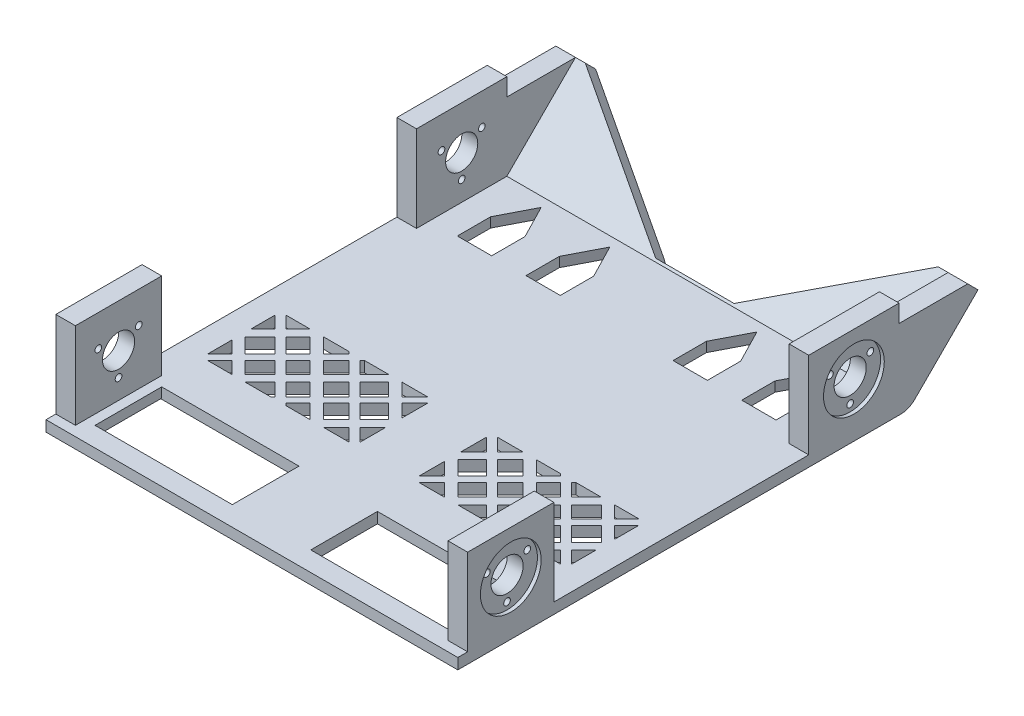
from build123d import *
from build123d.topology import SkipClean

# Parameters (mm, degrees)
SKETCH_1_W               = 5
SKETCH_1_H               = 10
EXTRUDE_1_DEPTH          = 5.5
SKETCH_3_W               = 5
SKETCH_3_H               = 46.066203836
SKETCH_3_H_2             = 44
EXTRUDE_2_DEPTH          = 44
CUT_EXTRUDE_1_DEPTH      = 316.357337
CUT_EXTRUDE_1_DEPTH_BACK = 316.357337
SKETCH_4_R               = 8.2
SKETCH_4_R_2             = 1.7
SKETCH_5_R               = 15.5
CUT_EXTRUDE_3_DEPTH      = 1.9
CUT_EXTRUDE_START        = -1.9
SKETCH_6_R               = 15.5
CUT_EXTRUDE_4_DEPTH      = 1.9
CUT_EXTRUDE_5_DEPTH      = 316.357337
CUT_EXTRUDE_5_DEPTH_BACK = 316.357337
SKETCH_7_R               = 8.2
SKETCH_7_R_2             = 1.7
SKETCH_8_R               = 15.5
CUT_EXTRUDE_6_DEPTH      = 1.9
SKETCH_9_R               = 15.5
CUT_EXTRUDE_7_DEPTH      = 1.9
SKETCH_10_W              = 10
SKETCH_10_H              = 34
EXTRUDE_3_DEPTH          = 5
SKETCH_11_W              = 5
SKETCH_11_H              = 41.066203836
SKETCH_11_H_2            = 5
SKETCH_11_H_3            = 44
EXTRUDE_4_DEPTH          = 44
CUT_EXTRUDE_8_DEPTH      = 315.095304008
CUT_EXTRUDE_8_DEPTH_BACK = 315.095304008
SKETCH_12_R              = 1.7
SKETCH_12_R_2            = 8.2
SKETCH_17_W              = 210
SKETCH_17_H              = 49.493882771
EXTRUDE_5_DEPTH          = 7.424621
EXTRUDE_6_DEPTH          = 10
EXTRUDE_8_DEPTH          = 10
SKETCH_20_W              = 40
SKETCH_20_H              = 48.239190952
CUT_EXTRUDE_9_DEPTH      = 10
EXTRUDE_11_DEPTH         = 5
EXTRUDE_13_DEPTH         = 210
FILLET_1_R               = 10
EXTRUDE_14_DEPTH         = 5
CUT_EXTRUDE_10_DEPTH     = 5.5


with BuildPart() as part:
    # 草图1 → 凸台-拉伸1 (new body)
    with BuildSketch(Plane(origin=(0, 0, 0), x_dir=(1, 0, 0), z_dir=(0, 1, 0))):
        Polygon((85, -44), (5, -44), (5, -186), (85, -186), (85, -220), (125, -220), (125, -186), (205, -186), (205, -44), (125, -44), (125, -10), (85, -10), align=None)
        Polygon((3, 0), (0, 0), (0, -10), (5, -10), (5, 0), align=None)
        Polygon((5, -10), (0, -10), (0, -220), (5, -220), (5, -186), (5, -44), align=None)
        Polygon((205, 0), (5, 0), (5, -10), (85, -10), (125, -10), (205, -10), align=None)
        Polygon((210, -10), (205, -10), (205, -44), (205, -186), (205, -220), (210, -220), align=None)
        with Locations((207.5, -5)):
            Rectangle(SKETCH_1_W, SKETCH_1_H)
        Polygon((85, -220), (5, -220), (5, -230), (205, -230), (205, -220), (125, -220), align=None)
        with Locations((2.5, -225)):
            Rectangle(SKETCH_1_W, SKETCH_1_H)
        with Locations((207.5, -225)):
            Rectangle(SKETCH_1_W, SKETCH_1_H)
    extrude(amount=EXTRUDE_1_DEPTH)

    # 草图3 → 凸台-拉伸2 (add)
    with BuildSketch(Plane(origin=(0, 5.5, 0), x_dir=(1, 0, 0), z_dir=(0, 1, 0))):
        with Locations((2.5, -28.033101918)):
            Rectangle(SKETCH_3_W, SKETCH_3_H)
        with Locations((2.5, -203)):
            Rectangle(SKETCH_3_W, SKETCH_3_H_2)
        with Locations((207.5, -203)):
            Rectangle(SKETCH_3_W, SKETCH_3_H_2)
        with Locations((207.5, -28.033101918)):
            Rectangle(SKETCH_3_W, SKETCH_3_H)
    extrude(amount=EXTRUDE_2_DEPTH)

    # 草图4 → 切除-拉伸1 (cut, two sides: drawn at the far end of the back side and taken through both)
    with BuildSketch(Plane.ZY.offset(-CUT_EXTRUDE_1_DEPTH_BACK)):
        with Locations((28.033101918, 27.5)):
            Circle(SKETCH_4_R)
        with Locations((28.033101918, 15.6)):
            Circle(SKETCH_4_R_2)
        with Locations((17.727399613, 33.45)):
            Circle(SKETCH_4_R_2)
        with Locations((38.338804223, 33.45)):
            Circle(SKETCH_4_R_2)
    extrude(amount=CUT_EXTRUDE_1_DEPTH + CUT_EXTRUDE_1_DEPTH_BACK, mode=Mode.SUBTRACT)

    # 草图5 → 切除-拉伸3 (cut)
    with BuildSketch(Plane.ZY):
        with Locations((28.033101918, 27.5)):
            Circle(SKETCH_5_R)
    extrude(amount=-CUT_EXTRUDE_3_DEPTH, mode=Mode.SUBTRACT)

    # 草图6 → 切除-拉伸4 (cut)
    with BuildSketch(Plane(origin=(210, 0, 0), x_dir=(0, 0, -1), z_dir=(1, 0, 0)).offset(CUT_EXTRUDE_START)):
        with Locations(Location((-28.033101918, 27.5, 0), (0, 0, 180))):
            Circle(SKETCH_6_R)
    extrude(amount=CUT_EXTRUDE_4_DEPTH, mode=Mode.SUBTRACT)

    # 草图7 → 切除-拉伸5 (cut, two sides: drawn at the far end of the back side and taken through both)
    with BuildSketch(Plane.ZY.offset(-CUT_EXTRUDE_5_DEPTH_BACK)):
        with Locations((203, 27.5)):
            Circle(SKETCH_7_R)
        with Locations((203, 15.6)):
            Circle(SKETCH_7_R_2)
        with Locations((192.694297695, 33.45)):
            Circle(SKETCH_7_R_2)
        with Locations((213.305702305, 33.45)):
            Circle(SKETCH_7_R_2)
    extrude(amount=CUT_EXTRUDE_5_DEPTH + CUT_EXTRUDE_5_DEPTH_BACK, mode=Mode.SUBTRACT)

    # 草图8 → 切除-拉伸6 (cut)
    with BuildSketch(Plane.ZY):
        with Locations((203, 27.5)):
            Circle(SKETCH_8_R)
    extrude(amount=-CUT_EXTRUDE_6_DEPTH, mode=Mode.SUBTRACT)

    # 草图9 → 切除-拉伸7 (cut)
    with BuildSketch(Plane(origin=(210, 0, 0), x_dir=(0, 0, -1), z_dir=(1, 0, 0)).offset(CUT_EXTRUDE_START)):
        with Locations(Location((-203, 27.5, 0), (0, 0, 180))):
            Circle(SKETCH_9_R)
    extrude(amount=CUT_EXTRUDE_7_DEPTH, mode=Mode.SUBTRACT)

    # 草图10 → 凸台-拉伸3 (add)
    with BuildSketch(Plane(origin=(0, 5.5, 0), x_dir=(1, 0, 0), z_dir=(0, 1, 0))):
        with Locations((200, -27)):
            Rectangle(SKETCH_10_W, SKETCH_10_H)
        with Locations((10, -27)):
            Rectangle(SKETCH_10_W, SKETCH_10_H)
        with Locations((10, -203)):
            Rectangle(SKETCH_10_W, SKETCH_10_H)
        with Locations((200, -203)):
            Rectangle(SKETCH_10_W, SKETCH_10_H)
    extrude(amount=-EXTRUDE_3_DEPTH)

    # 草图11 → 凸台-拉伸4 (add)
    with BuildSketch(Plane(origin=(0, 5.5, 0), x_dir=(1, 0, 0), z_dir=(0, 1, 0))):
        with Locations((7.5, -30.533101918)):
            Rectangle(SKETCH_11_W, SKETCH_11_H)
        with Locations((7.5, -7.5)):
            Rectangle(SKETCH_11_W, SKETCH_11_H_2)
        with Locations((202.5, -7.5)):
            Rectangle(SKETCH_11_W, SKETCH_11_H_2)
        with Locations((202.5, -30.533101918)):
            Rectangle(SKETCH_11_W, SKETCH_11_H)
        with Locations((7.5, -203)):
            Rectangle(SKETCH_11_W, SKETCH_11_H_3)
        with Locations((202.5, -203)):
            Rectangle(SKETCH_11_W, SKETCH_11_H_3)
    extrude(amount=EXTRUDE_4_DEPTH)

    # 草图12 → 切除-拉伸8 (cut, two sides: drawn at the far end of the back side and taken through both)
    with BuildSketch(Plane.ZY.offset(-1.9).offset(-CUT_EXTRUDE_8_DEPTH_BACK)):
        with Locations(Location((17.727399613, 33.45, 0), (0, 0, 180))):
            Circle(SKETCH_12_R)
        with Locations(Location((38.338804223, 33.45, 0), (0, 0, 180))):
            Circle(SKETCH_12_R)
        with Locations(Location((28.033101918, 15.6, 0), (0, 0, 180))):
            Circle(SKETCH_12_R)
        with Locations(Location((28.033101918, 27.5, 0), (0, 0, 180))):
            Circle(SKETCH_12_R_2)
        with Locations(Location((192.694297695, 33.45, 0), (0, 0, 180))):
            Circle(SKETCH_12_R)
        with Locations(Location((213.305702305, 33.45, 0), (0, 0, 180))):
            Circle(SKETCH_12_R)
        with Locations(Location((203, 15.6, 0), (0, 0, 180))):
            Circle(SKETCH_12_R)
        with Locations(Location((203, 27.5, 0), (0, 0, 180))):
            Circle(SKETCH_12_R_2)
    extrude(amount=CUT_EXTRUDE_8_DEPTH + CUT_EXTRUDE_8_DEPTH_BACK, mode=Mode.SUBTRACT)

    # 草图17 → 凸台-拉伸5 (add, through all)
    with BuildSketch(Plane(origin=(0, 5.25, 5.25), x_dir=(1, 0, 0), z_dir=(0, 0.7071067811865464, 0.7071067811865487))):
        with Locations((105, 25.100494776)):
            Rectangle(SKETCH_17_W, SKETCH_17_H)
    extrude(amount=-EXTRUDE_5_DEPTH)

    # 草图18 → 凸台-拉伸6 (add)
    with BuildSketch(Plane.ZY):
        Polygon((-29.997460135, 40.497460135), (5, 40.5), (5, 5.5), align=None)
    extrude(amount=-EXTRUDE_6_DEPTH)

    # 草图19 → 凸台-拉伸8 (add)
    with BuildSketch(Plane(origin=(210, 0, 0), x_dir=(0, 0, -1), z_dir=(1, 0, 0))):
        Polygon((30, 40.5), (-5, 40.5), (-5, 5.5), align=None)
    extrude(amount=-EXTRUDE_8_DEPTH)

    # 草图20 → 切除-拉伸9 (cut)
    with BuildSketch(Plane(origin=(0, 5.25, 5.25), x_dir=(1, 0, 0), z_dir=(0, 0.7071067811865465, 0.7071067811865487))):
        Polygon((85, 49.847436162), (15, 49.847436162), (85, 1.60824521), align=None)
        with Locations((105, 25.727840686)):
            Rectangle(SKETCH_20_W, SKETCH_20_H)
        Polygon((125, 49.847436162), (125, 1.60824521), (195, 49.847436162), align=None)
    extrude(amount=-CUT_EXTRUDE_9_DEPTH, mode=Mode.SUBTRACT)

    # 草图21 → 凸台-拉伸11 (add)
    with BuildSketch(Plane(origin=(0, 5.5, 0), x_dir=(1, 0, 0), z_dir=(0, 1, 0))):
        Polygon((15, -44), (32.5, -10), (15, -10), align=None)
        Polygon((67.5, -10), (32.5, -10), (41.25, -27), (50, -44), (58.75, -27), align=None)
        Polygon((50, -44), (41.25, -27), (41.25, -44), align=None)
        Polygon((58.75, -27), (50, -44), (58.75, -44), align=None)
        Polygon((85, -10), (67.5, -10), (85, -44), align=None)
        Polygon((125, -10), (125, -44), (142.5, -10), align=None)
        Polygon((177.5, -10), (142.5, -10), (151.25, -27), (160, -44), (168.75, -27), align=None)
        Polygon((195, -10), (177.5, -10), (195, -44), align=None)
        Polygon((168.75, -27), (160, -44), (168.75, -44), align=None)
        Polygon((151.25, -27), (151.25, -44), (160, -44), align=None)
    extrude(amount=-EXTRUDE_11_DEPTH)

    # 草图22 → 凸台-拉伸13 (add)
    with SkipClean():  # the faces are left unmerged after this step: merging them gives an invalid solid
        with BuildSketch(Plane.ZY):
            Polygon((0, 0.5), (0, 0), (-0.25, 0.25), align=None)
        extrude(amount=-EXTRUDE_13_DEPTH)

    # 圆角1
    # the kernel refuses this fillet: 10 mm, written as the material it takes off along each edge
    with BuildSketch(Plane(origin=(220.355339059, 0, 0), x_dir=(0, 0, 1), z_dir=(-1, 0, 0))) as fillet_1_piece_1:
        with BuildLine():
            CenterArc((FILLET_1_R * 0.414213562373, FILLET_1_R), FILLET_1_R, 225, 45)
            Line((-FILLET_1_R * 0.292893218813, FILLET_1_R * 0.292893218813), (0, 0))
            Line((0, 0), (FILLET_1_R * 0.414213562373, 0))
        make_face()
    extrude(amount=230.710678119, mode=Mode.SUBTRACT)

    # 草图23 → 凸台-拉伸14 (add)
    with BuildSketch(Plane(origin=(0, 5.5, 0), x_dir=(1, 0, 0), z_dir=(0, 1, 0))):
        Polygon((23.75, -27), (23.75, -44), (15, -44), align=None)
        Polygon((76.25, -27), (76.25, -44), (85, -44), align=None)
        Polygon((133.75, -27), (133.75, -44), (125, -44), align=None)
        Polygon((186.25, -27), (186.25, -44), (195, -44), align=None)
    extrude(amount=-EXTRUDE_14_DEPTH)

    # 草图24 → 切除-拉伸10 (cut)
    with BuildSketch(Plane(origin=(0, 5.5, 0), x_dir=(1, 0, 0), z_dir=(0, 1, 0))):
        Polygon((90, -159.829588879), (90, -146.857030495), (83.513720808, -153.343309687), align=None)
        Polygon((80.083491149, -135.34609773), (87.366982297, -142.629588879), (80.083491149, -149.913080027), (72.8, -142.629588879), align=None)
        Polygon((80.713720808, -156.143309687), (74.227441616, -162.629588879), (87.2, -162.629588879), align=None)
        Polygon((70, -145.429588879), (77.283491149, -152.713080027), (70.797211957, -159.199359219), (63.513720808, -151.915868071), align=None)
        Polygon((87.2, -122.629588879), (74.227441616, -122.629588879), (80.713720808, -129.115868071), align=None)
        Polygon((90, -138.402147263), (90, -125.429588879), (83.513720808, -131.915868071), align=None)
        Polygon((70, -139.829588879), (63.513720808, -133.343309687), (70.797211957, -126.059818538), (77.283491149, -132.54609773), align=None)
        Polygon((67.2, -142.629588879), (60.713720808, -149.115868071), (54.227441616, -142.629588879), (60.713720808, -136.143309687), align=None)
        Polygon((67.366982297, -122.629588879), (55, -122.629588879), (53.9, -123.729588879), (60.083491149, -129.913080027), align=None)
        Polygon((57.283491149, -132.713080027), (50.797211957, -139.199359219), (44.613720808, -133.015868071), (51.1, -126.529588879), align=None)
        Polygon((53.9, -161.529588879), (55, -162.629588879), (67.366982297, -162.629588879), (60.083491149, -155.34609773), align=None)
        Polygon((50.797211957, -146.059818538), (57.283491149, -152.54609773), (51.1, -158.729588879), (44.613720808, -152.243309687), align=None)
        Polygon((47.366982297, -142.629588879), (41.183491149, -148.813080027), (35, -142.629588879), (41.183491149, -136.44609773), align=None)
        Polygon((47.2, -122.629588879), (34.227441616, -122.629588879), (41.813720808, -130.215868071), (48.3, -123.729588879), align=None)
        Polygon((41.813720808, -155.043309687), (34.227441616, -162.629588879), (47.2, -162.629588879), (48.3, -161.529588879), align=None)
        Polygon((38.383491149, -151.613080027), (30.797211957, -159.199359219), (24.613720808, -153.015868071), (32.2, -145.429588879), align=None)
        Polygon((24.613720808, -132.243309687), (32.2, -139.829588879), (38.383491149, -133.64609773), (30.797211957, -126.059818538), align=None)
        Polygon((21.813720808, -150.215868071), (14.227441616, -142.629588879), (21.813720808, -135.043309687), (29.4, -142.629588879), align=None)
        Polygon((27.366982297, -122.629588879), (15, -122.629588879), (21.183491149, -128.813080027), align=None)
        Polygon((18.383491149, -131.613080027), (12.2, -125.429588879), (12.2, -137.796571176), align=None)
        Polygon((18.383491149, -153.64609773), (12.2, -147.462606582), (12.2, -159.829588879), align=None)
        Polygon((21.183491149, -156.44609773), (15, -162.629588879), (27.366982297, -162.629588879), align=None)
        Polygon((155.772558384, -142.629588879), (149.286279192, -149.115868071), (142.8, -142.629588879), (149.286279192, -136.143309687), align=None)
        Polygon((165.386279192, -152.243309687), (158.9, -158.729588879), (152.716508851, -152.54609773), (159.202788043, -146.059818538), align=None)
        Polygon((175, -142.629588879), (168.816508851, -136.44609773), (162.633017703, -142.629588879), (168.816508851, -148.813080027), align=None)
        Polygon((165.386279192, -133.015868071), (159.202788043, -139.199359219), (152.716508851, -132.713080027), (158.9, -126.529588879), align=None)
        Polygon((179.202788043, -126.059818538), (185.386279192, -132.243309687), (177.8, -139.829588879), (171.616508851, -133.64609773), align=None)
        Polygon((168.186279192, -130.215868071), (175.772558384, -122.629588879), (162.8, -122.629588879), (161.7, -123.729588879), align=None)
        Polygon((188.816508851, -128.813080027), (195, -122.629588879), (182.633017703, -122.629588879), align=None)
        Polygon((191.616508851, -131.613080027), (197.8, -137.796571176), (197.8, -125.429588879), align=None)
        Polygon((188.186279192, -135.043309687), (195.772558384, -142.629588879), (188.186279192, -150.215868071), (180.6, -142.629588879), align=None)
        Polygon((191.616508851, -153.64609773), (197.8, -159.829588879), (197.8, -147.462606582), align=None)
        Polygon((182.633017703, -162.629588879), (195, -162.629588879), (188.816508851, -156.44609773), align=None)
        Polygon((171.616508851, -151.613080027), (179.202788043, -159.199359219), (185.386279192, -153.015868071), (177.8, -145.429588879), align=None)
        Polygon((162.8, -162.629588879), (175.772558384, -162.629588879), (168.186279192, -155.043309687), (161.7, -161.529588879), align=None)
        Polygon((142.633017703, -162.629588879), (155, -162.629588879), (156.1, -161.529588879), (149.916508851, -155.34609773), align=None)
        Polygon((139.202788043, -159.199359219), (132.716508851, -152.713080027), (140, -145.429588879), (146.486279192, -151.915868071), align=None)
        Polygon((122.8, -162.629588879), (135.772558384, -162.629588879), (129.286279192, -156.143309687), align=None)
        Polygon((120, -146.857030495), (120, -159.829588879), (126.486279192, -153.343309687), align=None)
        Polygon((139.202788043, -126.059818538), (146.486279192, -133.343309687), (140, -139.829588879), (132.716508851, -132.54609773), align=None)
        Polygon((156.1, -123.729588879), (155, -122.629588879), (142.633017703, -122.629588879), (149.916508851, -129.913080027), align=None)
        Polygon((129.916508851, -135.34609773), (137.2, -142.629588879), (129.916508851, -149.913080027), (122.633017703, -142.629588879), align=None)
        Polygon((129.286279192, -129.115868071), (135.772558384, -122.629588879), (122.8, -122.629588879), align=None)
        Polygon((120, -125.429588879), (120, -138.402147263), (126.486279192, -131.915868071), align=None)
    extrude(amount=-CUT_EXTRUDE_10_DEPTH, mode=Mode.SUBTRACT)


solid = part.part
